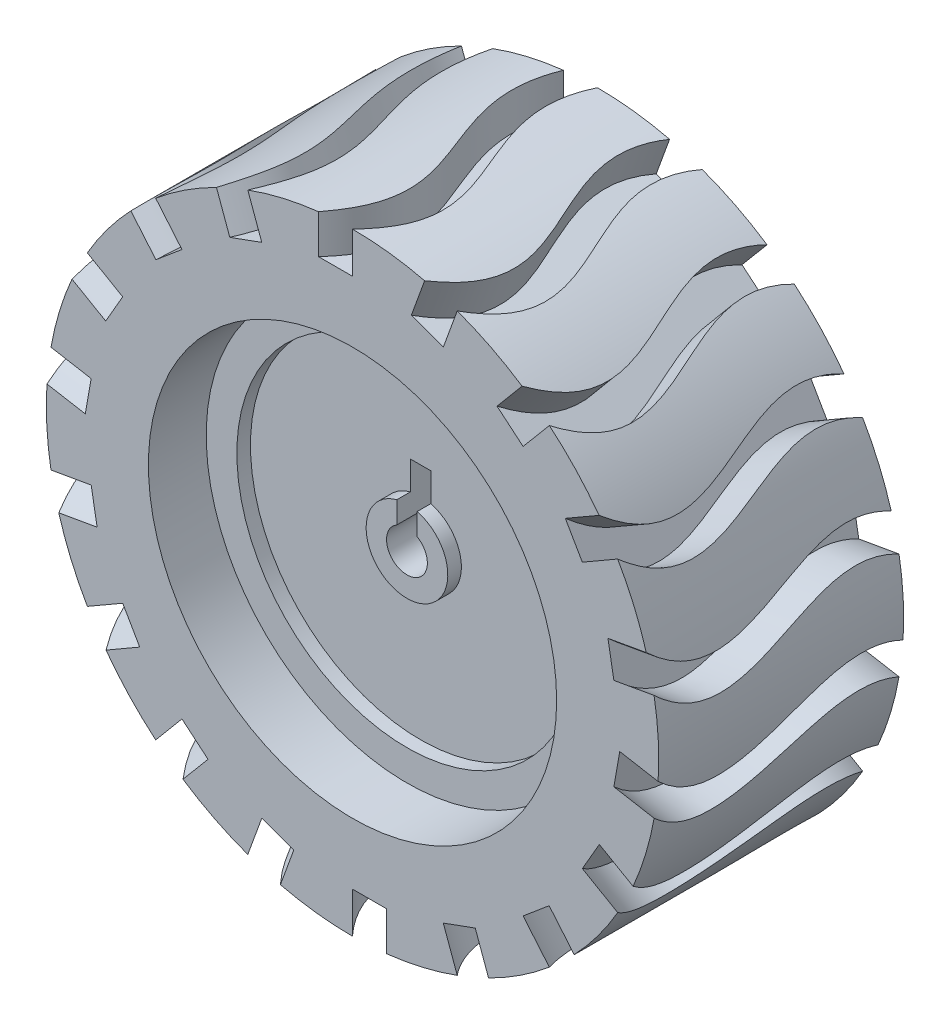
from build123d import *

# Parameters (mm, degrees)
SKETCH1_R            = 22.5
BOSS_EXTRUDE1_DEPTH  = 18
CUT_EXTRUDE1_DEPTH   = 5.5
CIRPATTERN1_START    = -22.500000114
CIRPATTERN1_DEPTH    = 3.000000114
CIRPATTERN1_START_2  = 19.5
CIRPATTERN1_2_DEPTH  = 3
CIRPATTERN1_3_DEPTH  = 3.000000114
CIRPATTERN1_4_DEPTH  = 3
CIRPATTERN1_5_DEPTH  = 3.000000114
CIRPATTERN1_6_DEPTH  = 3
CIRPATTERN1_7_DEPTH  = 3.000000114
CIRPATTERN1_8_DEPTH  = 3
CIRPATTERN1_9_DEPTH  = 3.000000114
CIRPATTERN1_10_DEPTH = 3
CIRPATTERN1_11_DEPTH = 3.000000114
CIRPATTERN1_12_DEPTH = 3
CIRPATTERN1_13_DEPTH = 3.000000114
CIRPATTERN1_14_DEPTH = 3
CIRPATTERN1_15_DEPTH = 3.000000114
CIRPATTERN1_16_DEPTH = 3
CIRPATTERN1_17_DEPTH = 3.000000114
SKETCH3_R            = 15
CUT_EXTRUDE2_DEPTH   = 18
SKETCH4_R            = 14.75
BOSS_EXTRUDE2_DEPTH  = 18
SKETCH5_R            = 14.75
CUT_EXTRUDE4_DEPTH   = 4
SKETCH6_R            = 14.75
CUT_EXTRUDE5_DEPTH   = 4
SKETCH7_R            = 12.5
SKETCH7_R_2          = 3
CUT_EXTRUDE11_DEPTH  = 1
SKETCH8_R            = 1.5
CUT_EXTRUDE12_DEPTH  = 20
SKETCH9_R            = 14.75
CUT_EXTRUDE13_DEPTH  = 1
SKETCH10_R           = 14.75
BOSS_EXTRUDE5_DEPTH  = 1
BOSS_EXTRUDE6_DEPTH  = 4
CUT_EXTRUDE14_DEPTH  = 20


# Read off the part's stored shape, not the designer's step: CirPattern1
with BuildPart() as part:
    # Sketch1 → Boss-Extrude1 (new body)
    with BuildSketch(Plane.XY):
        Circle(SKETCH1_R)
    extrude(amount=BOSS_EXTRUDE1_DEPTH)

    # Sketch2 → Cut-Extrude1 (cut)
    with BuildSketch(Plane(origin=(0, 25, 0), x_dir=(1, 0, 0), z_dir=(0, 1, 0))):
        with BuildLine():
            Line((-2.5, 0), (0, 0))
            add(Edge.make_bspline(
                [(0, 0), (-3.296301702, -6.593771616), (5.89267884, -11.683586078), (0, -18)],
                knots=[0, 0, 0, 0, 1, 1, 1, 1], degree=3))
            Line((0, -18), (-2.5, -18))
            add(Edge.make_bspline(
                [(-2.5, 0), (-5.796301702, -6.593771616), (3.39267884, -11.683586078), (-2.5, -18)],
                knots=[0, 0, 0, 0, 1, 1, 1, 1], degree=3))
        make_face()
    extrude(amount=-CUT_EXTRUDE1_DEPTH, mode=Mode.SUBTRACT)

    # CirPattern1 outline → CirPattern1 (cut)
    with BuildSketch(Plane(origin=(0, 0, 0), x_dir=(0.9396926207859082, 0.3420201433256691, 0), z_dir=(0.3420201433256691, -0.9396926207859083, 0)).offset(CIRPATTERN1_START)):
        with BuildLine():
            Line((-2.5, 0), (0, 0))
            add(Edge.make_bspline(
                [(0, 0), (-3.296301702, 6.593771616), (5.89267884, 11.683586078), (0, 18)],
                knots=[0.64127667, 0.64127667, 0.64127667, 0.64127667, 1.64127667, 1.64127667, 1.64127667, 1.64127667], degree=3))
            Line((0, 18), (-2.5, 18))
            add(Edge.make_bspline(
                [(-2.5, 18), (3.39267884, 11.683586078), (-5.796301702, 6.593771616), (-2.5, 0)],
                knots=[0.909473215, 0.909473215, 0.909473215, 0.909473215, 1.909473215, 1.909473215, 1.909473215, 1.909473215], degree=3))
        make_face()
    extrude(amount=CIRPATTERN1_DEPTH, mode=Mode.SUBTRACT)

    # CirPattern1 2 outline → CirPattern1 2 (cut)
    with BuildSketch(Plane(origin=(0, 0, 0), x_dir=(0.9396926207859082, 0.3420201433256691, 0), z_dir=(0.3420201433256691, -0.9396926207859083, 0)).offset(CIRPATTERN1_START_2)):
        with BuildLine():
            Line((0, 0), (2.5, 0))
            add(Edge.make_bspline(
                [(2.5, 0), (5.796301702, 6.593771616), (-3.39267884, 11.683586078), (2.5, 18)],
                knots=[0, 0, 0, 0, 1, 1, 1, 1], degree=3))
            Line((2.5, 18), (0, 18))
            add(Edge.make_bspline(
                [(0, 18), (-5.89267884, 11.683586078), (3.296301702, 6.593771616), (0, 0)],
                knots=[0, 0, 0, 0, 1, 1, 1, 1], degree=3))
        make_face()
    extrude(amount=CIRPATTERN1_2_DEPTH, mode=Mode.SUBTRACT)

    # CirPattern1 3 outline → CirPattern1 3 (cut)
    with BuildSketch(Plane(origin=(0, 0, 0), x_dir=(0.7660444431189772, 0.6427876096865403, 0), z_dir=(0.6427876096865403, -0.7660444431189772, 0)).offset(CIRPATTERN1_START)):
        with BuildLine():
            Line((-2.5, 0), (0, 0))
            add(Edge.make_bspline(
                [(0, 0), (-3.296301702, 6.593771616), (5.89267884, 11.683586078), (0, 18)],
                knots=[0.64127667, 0.64127667, 0.64127667, 0.64127667, 1.64127667, 1.64127667, 1.64127667, 1.64127667], degree=3))
            Line((0, 18), (-2.5, 18))
            add(Edge.make_bspline(
                [(-2.5, 18), (3.39267884, 11.683586078), (-5.796301702, 6.593771616), (-2.5, 0)],
                knots=[0.909473215, 0.909473215, 0.909473215, 0.909473215, 1.909473215, 1.909473215, 1.909473215, 1.909473215], degree=3))
        make_face()
    extrude(amount=CIRPATTERN1_3_DEPTH, mode=Mode.SUBTRACT)

    # CirPattern1 4 outline → CirPattern1 4 (cut)
    with BuildSketch(Plane(origin=(0, 0, 0), x_dir=(0.7660444431189772, 0.6427876096865403, 0), z_dir=(0.6427876096865403, -0.7660444431189772, 0)).offset(CIRPATTERN1_START_2)):
        with BuildLine():
            Line((0, 0), (2.5, 0))
            add(Edge.make_bspline(
                [(2.5, 0), (5.796301702, 6.593771616), (-3.39267884, 11.683586078), (2.5, 18)],
                knots=[0, 0, 0, 0, 1, 1, 1, 1], degree=3))
            Line((2.5, 18), (0, 18))
            add(Edge.make_bspline(
                [(0, 18), (-5.89267884, 11.683586078), (3.296301702, 6.593771616), (0, 0)],
                knots=[0, 0, 0, 0, 1, 1, 1, 1], degree=3))
        make_face()
    extrude(amount=CIRPATTERN1_4_DEPTH, mode=Mode.SUBTRACT)

    # CirPattern1 5 outline → CirPattern1 5 (cut)
    with BuildSketch(Plane(origin=(0, 0, 0), x_dir=(0.49999999999999833, 0.8660254037844396, 0), z_dir=(0.8660254037844397, -0.49999999999999784, 0)).offset(CIRPATTERN1_START)):
        with BuildLine():
            Line((-2.5, 0), (0, 0))
            add(Edge.make_bspline(
                [(0, 0), (-3.296301702, 6.593771616), (5.89267884, 11.683586078), (0, 18)],
                knots=[0.64127667, 0.64127667, 0.64127667, 0.64127667, 1.64127667, 1.64127667, 1.64127667, 1.64127667], degree=3))
            Line((0, 18), (-2.5, 18))
            add(Edge.make_bspline(
                [(-2.5, 18), (3.39267884, 11.683586078), (-5.796301702, 6.593771616), (-2.5, 0)],
                knots=[0.909473215, 0.909473215, 0.909473215, 0.909473215, 1.909473215, 1.909473215, 1.909473215, 1.909473215], degree=3))
        make_face()
    extrude(amount=CIRPATTERN1_5_DEPTH, mode=Mode.SUBTRACT)

    # CirPattern1 6 outline → CirPattern1 6 (cut)
    with BuildSketch(Plane(origin=(0, 0, 0), x_dir=(0.49999999999999833, 0.8660254037844396, 0), z_dir=(0.8660254037844397, -0.49999999999999784, 0)).offset(CIRPATTERN1_START_2)):
        with BuildLine():
            Line((0, 0), (2.5, 0))
            add(Edge.make_bspline(
                [(2.5, 0), (5.796301702, 6.593771616), (-3.39267884, 11.683586078), (2.5, 18)],
                knots=[0, 0, 0, 0, 1, 1, 1, 1], degree=3))
            Line((2.5, 18), (0, 18))
            add(Edge.make_bspline(
                [(0, 18), (-5.89267884, 11.683586078), (3.296301702, 6.593771616), (0, 0)],
                knots=[0, 0, 0, 0, 1, 1, 1, 1], degree=3))
        make_face()
    extrude(amount=CIRPATTERN1_6_DEPTH, mode=Mode.SUBTRACT)

    # CirPattern1 7 outline → CirPattern1 7 (cut)
    with BuildSketch(Plane(origin=(0, 0, 0), x_dir=(0.1736481776669279, 0.9848077530122085, 0), z_dir=(0.9848077530122085, -0.1736481776669279, 0)).offset(CIRPATTERN1_START)):
        with BuildLine():
            Line((-2.5, 0), (0, 0))
            add(Edge.make_bspline(
                [(0, 0), (-3.296301702, 6.593771616), (5.89267884, 11.683586078), (0, 18)],
                knots=[0.64127667, 0.64127667, 0.64127667, 0.64127667, 1.64127667, 1.64127667, 1.64127667, 1.64127667], degree=3))
            Line((0, 18), (-2.5, 18))
            add(Edge.make_bspline(
                [(-2.5, 18), (3.39267884, 11.683586078), (-5.796301702, 6.593771616), (-2.5, 0)],
                knots=[0.909473215, 0.909473215, 0.909473215, 0.909473215, 1.909473215, 1.909473215, 1.909473215, 1.909473215], degree=3))
        make_face()
    extrude(amount=CIRPATTERN1_7_DEPTH, mode=Mode.SUBTRACT)

    # CirPattern1 8 outline → CirPattern1 8 (cut)
    with BuildSketch(Plane(origin=(0, 0, 0), x_dir=(0.1736481776669279, 0.9848077530122085, 0), z_dir=(0.9848077530122085, -0.1736481776669279, 0)).offset(CIRPATTERN1_START_2)):
        with BuildLine():
            Line((0, 0), (2.5, 0))
            add(Edge.make_bspline(
                [(2.5, 0), (5.796301702, 6.593771616), (-3.39267884, 11.683586078), (2.5, 18)],
                knots=[0, 0, 0, 0, 1, 1, 1, 1], degree=3))
            Line((2.5, 18), (0, 18))
            add(Edge.make_bspline(
                [(0, 18), (-5.89267884, 11.683586078), (3.296301702, 6.593771616), (0, 0)],
                knots=[0, 0, 0, 0, 1, 1, 1, 1], degree=3))
        make_face()
    extrude(amount=CIRPATTERN1_8_DEPTH, mode=Mode.SUBTRACT)

    # CirPattern1 9 outline → CirPattern1 9 (cut)
    with BuildSketch(Plane(origin=(0, 0, 0), x_dir=(-0.17364817766693394, 0.9848077530122075, 0), z_dir=(0.9848077530122076, 0.1736481776669339, 0)).offset(CIRPATTERN1_START)):
        with BuildLine():
            Line((-2.5, 0), (0, 0))
            add(Edge.make_bspline(
                [(0, 0), (-3.296301702, 6.593771616), (5.89267884, 11.683586078), (0, 18)],
                knots=[0.64127667, 0.64127667, 0.64127667, 0.64127667, 1.64127667, 1.64127667, 1.64127667, 1.64127667], degree=3))
            Line((0, 18), (-2.5, 18))
            add(Edge.make_bspline(
                [(-2.5, 18), (3.39267884, 11.683586078), (-5.796301702, 6.593771616), (-2.5, 0)],
                knots=[0.909473215, 0.909473215, 0.909473215, 0.909473215, 1.909473215, 1.909473215, 1.909473215, 1.909473215], degree=3))
        make_face()
    extrude(amount=CIRPATTERN1_9_DEPTH, mode=Mode.SUBTRACT)

    # CirPattern1 10 outline → CirPattern1 10 (cut)
    with BuildSketch(Plane(origin=(0, 0, 0), x_dir=(-0.17364817766693394, 0.9848077530122075, 0), z_dir=(0.9848077530122076, 0.1736481776669339, 0)).offset(CIRPATTERN1_START_2)):
        with BuildLine():
            Line((0, 0), (2.5, 0))
            add(Edge.make_bspline(
                [(2.5, 0), (5.796301702, 6.593771616), (-3.39267884, 11.683586078), (2.5, 18)],
                knots=[0, 0, 0, 0, 1, 1, 1, 1], degree=3))
            Line((2.5, 18), (0, 18))
            add(Edge.make_bspline(
                [(0, 18), (-5.89267884, 11.683586078), (3.296301702, 6.593771616), (0, 0)],
                knots=[0, 0, 0, 0, 1, 1, 1, 1], degree=3))
        make_face()
    extrude(amount=CIRPATTERN1_10_DEPTH, mode=Mode.SUBTRACT)

    # CirPattern1 11 outline → CirPattern1 11 (cut)
    with BuildSketch(Plane(origin=(0, 0, 0), x_dir=(0.5000000000000041, -0.8660254037844364, 0), z_dir=(0.8660254037844364, 0.5000000000000037, 0)).offset(CIRPATTERN1_START)):
        with BuildLine():
            Line((2.5, 0), (0, 0))
            add(Edge.make_bspline(
                [(0, 0), (3.296301702, -6.593771616), (-5.89267884, -11.683586078), (0, -18)],
                knots=[0.64127667, 0.64127667, 0.64127667, 0.64127667, 1.64127667, 1.64127667, 1.64127667, 1.64127667], degree=3))
            Line((0, -18), (2.5, -18))
            add(Edge.make_bspline(
                [(2.5, -18), (-3.39267884, -11.683586078), (5.796301702, -6.593771616), (2.5, 0)],
                knots=[0.909473215, 0.909473215, 0.909473215, 0.909473215, 1.909473215, 1.909473215, 1.909473215, 1.909473215], degree=3))
        make_face()
    extrude(amount=CIRPATTERN1_11_DEPTH, mode=Mode.SUBTRACT)

    # CirPattern1 12 outline → CirPattern1 12 (cut)
    with BuildSketch(Plane(origin=(0, 0, 0), x_dir=(0.5000000000000041, -0.8660254037844364, 0), z_dir=(0.8660254037844364, 0.5000000000000037, 0)).offset(CIRPATTERN1_START_2)):
        with BuildLine():
            Line((0, 0), (-2.5, 0))
            add(Edge.make_bspline(
                [(-2.5, 0), (-5.796301702, -6.593771616), (3.39267884, -11.683586078), (-2.5, -18)],
                knots=[0, 0, 0, 0, 1, 1, 1, 1], degree=3))
            Line((-2.5, -18), (0, -18))
            add(Edge.make_bspline(
                [(0, -18), (5.89267884, -11.683586078), (-3.296301702, -6.593771616), (0, 0)],
                knots=[0, 0, 0, 0, 1, 1, 1, 1], degree=3))
        make_face()
    extrude(amount=CIRPATTERN1_12_DEPTH, mode=Mode.SUBTRACT)

    # CirPattern1 13 outline → CirPattern1 13 (cut)
    with BuildSketch(Plane(origin=(0, 0, 0), x_dir=(0.7660444431189815, -0.6427876096865353, 0), z_dir=(0.6427876096865353, 0.7660444431189813, 0)).offset(CIRPATTERN1_START)):
        with BuildLine():
            Line((2.5, 0), (0, 0))
            add(Edge.make_bspline(
                [(0, 0), (3.296301702, -6.593771616), (-5.89267884, -11.683586078), (0, -18)],
                knots=[0.64127667, 0.64127667, 0.64127667, 0.64127667, 1.64127667, 1.64127667, 1.64127667, 1.64127667], degree=3))
            Line((0, -18), (2.5, -18))
            add(Edge.make_bspline(
                [(2.5, -18), (-3.39267884, -11.683586078), (5.796301702, -6.593771616), (2.5, 0)],
                knots=[0.909473215, 0.909473215, 0.909473215, 0.909473215, 1.909473215, 1.909473215, 1.909473215, 1.909473215], degree=3))
        make_face()
    extrude(amount=CIRPATTERN1_13_DEPTH, mode=Mode.SUBTRACT)

    # CirPattern1 14 outline → CirPattern1 14 (cut)
    with BuildSketch(Plane(origin=(0, 0, 0), x_dir=(0.7660444431189815, -0.6427876096865353, 0), z_dir=(0.6427876096865353, 0.7660444431189813, 0)).offset(CIRPATTERN1_START_2)):
        with BuildLine():
            Line((0, 0), (-2.5, 0))
            add(Edge.make_bspline(
                [(-2.5, 0), (-5.796301702, -6.593771616), (3.39267884, -11.683586078), (-2.5, -18)],
                knots=[0, 0, 0, 0, 1, 1, 1, 1], degree=3))
            Line((-2.5, -18), (0, -18))
            add(Edge.make_bspline(
                [(0, -18), (5.89267884, -11.683586078), (-3.296301702, -6.593771616), (0, 0)],
                knots=[0, 0, 0, 0, 1, 1, 1, 1], degree=3))
        make_face()
    extrude(amount=CIRPATTERN1_14_DEPTH, mode=Mode.SUBTRACT)

    # CirPattern1 15 outline → CirPattern1 15 (cut)
    with BuildSketch(Plane(origin=(0, 0, 0), x_dir=(0.9396926207859104, -0.3420201433256631, 0), z_dir=(0.34202014332566316, 0.9396926207859103, 0)).offset(CIRPATTERN1_START)):
        with BuildLine():
            Line((2.5, 0), (0, 0))
            add(Edge.make_bspline(
                [(0, 0), (3.296301702, -6.593771616), (-5.89267884, -11.683586078), (0, -18)],
                knots=[0.64127667, 0.64127667, 0.64127667, 0.64127667, 1.64127667, 1.64127667, 1.64127667, 1.64127667], degree=3))
            Line((0, -18), (2.5, -18))
            add(Edge.make_bspline(
                [(2.5, -18), (-3.39267884, -11.683586078), (5.796301702, -6.593771616), (2.5, 0)],
                knots=[0.909473215, 0.909473215, 0.909473215, 0.909473215, 1.909473215, 1.909473215, 1.909473215, 1.909473215], degree=3))
        make_face()
    extrude(amount=CIRPATTERN1_15_DEPTH, mode=Mode.SUBTRACT)

    # CirPattern1 16 outline → CirPattern1 16 (cut)
    with BuildSketch(Plane(origin=(0, 0, 0), x_dir=(0.9396926207859104, -0.3420201433256631, 0), z_dir=(0.34202014332566316, 0.9396926207859103, 0)).offset(CIRPATTERN1_START_2)):
        with BuildLine():
            Line((0, 0), (-2.5, 0))
            add(Edge.make_bspline(
                [(-2.5, 0), (-5.796301702, -6.593771616), (3.39267884, -11.683586078), (-2.5, -18)],
                knots=[0, 0, 0, 0, 1, 1, 1, 1], degree=3))
            Line((-2.5, -18), (0, -18))
            add(Edge.make_bspline(
                [(0, -18), (5.89267884, -11.683586078), (-3.296301702, -6.593771616), (0, 0)],
                knots=[0, 0, 0, 0, 1, 1, 1, 1], degree=3))
        make_face()
    extrude(amount=CIRPATTERN1_16_DEPTH, mode=Mode.SUBTRACT)

    # CirPattern1 17 outline → CirPattern1 17 (cut)
    with BuildSketch(Plane(origin=(0, 0, 0), x_dir=(1, 0, 0), z_dir=(0, 1, 0)).offset(CIRPATTERN1_START)):
        with BuildLine():
            add(Edge.make_bspline(
                [(2.5, 0), (5.796301702, -6.593771616), (-3.39267884, -11.683586078), (2.5, -18)],
                knots=[0, 0, 0, 0, 1, 1, 1, 1], degree=3))
            Line((2.5, 0), (0, 0))
            add(Edge.make_bspline(
                [(0, -18), (-5.89267884, -11.683586078), (3.296301702, -6.593771616), (0, 0)],
                knots=[0, 0, 0, 0, 1, 1, 1, 1], degree=3))
            Line((0, -18), (2.5, -18))
        make_face()
    extrude(amount=CIRPATTERN1_17_DEPTH, mode=Mode.SUBTRACT)

    # Sketch3 → Cut-Extrude2 (cut)
    with BuildSketch(Plane.XY.offset(18)):
        Circle(SKETCH3_R)
    extrude(amount=-CUT_EXTRUDE2_DEPTH, mode=Mode.SUBTRACT)


with BuildPart() as body_2:
    # Sketch4 → Boss-Extrude2 (new body)
    with BuildSketch(Plane.XY):
        Circle(SKETCH4_R)
    extrude(amount=BOSS_EXTRUDE2_DEPTH)

    # Sketch5 → Cut-Extrude4 (cut)
    with BuildSketch(Plane(origin=(0, 0, 0), x_dir=(-1, 0, 0), z_dir=(0, 0, -1))):
        Circle(SKETCH5_R)
    extrude(amount=-CUT_EXTRUDE4_DEPTH, mode=Mode.SUBTRACT)

    # Sketch6 → Cut-Extrude5 (cut)
    with BuildSketch(Plane.XY.offset(18)):
        with Locations(Location((0, 0, 0), (0, 0, 180))):
            Circle(SKETCH6_R)
    extrude(amount=-CUT_EXTRUDE5_DEPTH, mode=Mode.SUBTRACT)

    # Sketch7 → Cut-Extrude11 (cut)
    with BuildSketch(Plane.XY.offset(14)):
        Circle(SKETCH7_R)
        Circle(SKETCH7_R_2, mode=Mode.SUBTRACT)
    extrude(amount=-CUT_EXTRUDE11_DEPTH, mode=Mode.SUBTRACT)

    # Sketch8 → Cut-Extrude12 (cut)
    with BuildSketch(Plane.XY.offset(14)):
        Circle(SKETCH8_R)
    extrude(amount=-CUT_EXTRUDE12_DEPTH, mode=Mode.SUBTRACT)

    # Sketch9 → Cut-Extrude13 (cut)
    with BuildSketch(Plane(origin=(0, 0, 4), x_dir=(-1, 0, 0), z_dir=(0, 0, -1))):
        Circle(SKETCH9_R)
    extrude(amount=-CUT_EXTRUDE13_DEPTH, mode=Mode.SUBTRACT)

    # Sketch10 → Boss-Extrude5 (add)
    # profile 1 of 27: a face of its own
    with BuildSketch(Plane(origin=(0, 0, 5), x_dir=(-1, 0, 0), z_dir=(0, 0, -1))):
        Circle(SKETCH10_R)
        with BuildLine():
            ThreePointArc((-7.095993301, -10.290620927), (-10.825317547, -6.25), (-12.459935794, -1))
            Line((-12.459935794, -1), (-14, -1))
            Line((-14, -1), (-14, 1))
            Line((-14, 1), (-12.459935794, 1))
            ThreePointArc((-12.459935794, 1), (-10.825317547, 6.25), (-7.095993301, 10.290620927))
            Line((-7.095993301, 10.290620927), (-7.866025404, 11.624355653))
            Line((-7.866025404, 11.624355653), (-6.133974596, 12.624355653))
            Line((-6.133974596, 12.624355653), (-5.363942493, 11.290620927))
            ThreePointArc((-5.363942493, 11.290620927), (0, 12.5), (5.363942493, 11.290620927))
            Line((5.363942493, 11.290620927), (6.133974596, 12.624355653))
            Line((6.133974596, 12.624355653), (7.866025404, 11.624355653))
            Line((7.866025404, 11.624355653), (7.095993301, 10.290620927))
            ThreePointArc((7.095993301, 10.290620927), (10.825317547, 6.25), (12.459935794, 1))
            Line((12.459935794, 1), (14, 1))
            Line((14, 1), (14, -1))
            Line((14, -1), (12.459935794, -1))
            ThreePointArc((12.459935794, -1), (10.825317547, -6.25), (7.095993301, -10.290620927))
            Line((7.095993301, -10.290620927), (7.866025404, -11.624355653))
            Line((7.866025404, -11.624355653), (6.133974596, -12.624355653))
            Line((6.133974596, -12.624355653), (5.363942493, -11.290620927))
            ThreePointArc((5.363942493, -11.290620927), (0, -12.5), (-5.363942493, -11.290620927))
            Line((-5.363942493, -11.290620927), (-6.133974596, -12.624355653))
            Line((-6.133974596, -12.624355653), (-7.866025404, -11.624355653))
            Line((-7.866025404, -11.624355653), (-7.095993301, -10.290620927))
        make_face(mode=Mode.SUBTRACT)
    # profile 2 of 27: a face of its own
    with BuildSketch(Plane(origin=(0, 0, 5), x_dir=(-1, 0, 0), z_dir=(0, 0, -1))):
        with BuildLine():
            ThreePointArc((-0.548188159, -2.949489743), (-1.5, -2.598076211), (-2.280238966, -1.949489743))
            Line((-2.280238966, -1.949489743), (-7.095993301, -10.290620927))
            ThreePointArc((-7.095993301, -10.290620927), (-6.25, -10.825317547), (-5.363942493, -11.290620927))
            Line((-5.363942493, -11.290620927), (-0.548188159, -2.949489743))
        make_face()
    # profile 3 of 27: a face of its own
    with BuildSketch(Plane(origin=(0, 0, 5), x_dir=(-1, 0, 0), z_dir=(0, 0, -1))):
        with BuildLine():
            Line((-12.459935794, -1), (-2.828427125, -1))
            ThreePointArc((-2.828427125, -1), (-3, 0), (-2.828427125, 1))
            Line((-2.828427125, 1), (-12.459935794, 1))
            ThreePointArc((-12.459935794, 1), (-12.5, 0), (-12.459935794, -1))
        make_face()
    # profile 4 of 27: a face of its own
    with BuildSketch(Plane(origin=(0, 0, 5), x_dir=(-1, 0, 0), z_dir=(0, 0, -1))):
        with BuildLine():
            ThreePointArc((2.280238966, -1.949489743), (1.5, -2.598076211), (0.548188159, -2.949489743))
            Line((0.548188159, -2.949489743), (5.363942493, -11.290620927))
            ThreePointArc((5.363942493, -11.290620927), (6.25, -10.825317547), (7.095993301, -10.290620927))
            Line((7.095993301, -10.290620927), (2.280238966, -1.949489743))
        make_face()
    # profile 5 of 27: a face of its own
    with BuildSketch(Plane(origin=(0, 0, 5), x_dir=(-1, 0, 0), z_dir=(0, 0, -1))):
        with BuildLine():
            ThreePointArc((2.828427125, 1), (3, 0), (2.828427125, -1))
            Line((2.828427125, -1), (12.459935794, -1))
            ThreePointArc((12.459935794, -1), (12.489979933, -0.500401124), (12.5, 0))
            ThreePointArc((12.5, 0), (12.489979933, 0.500401124), (12.459935794, 1))
            Line((12.459935794, 1), (2.828427125, 1))
        make_face()
    # profile 6 of 27: a face of its own
    with BuildSketch(Plane(origin=(0, 0, 5), x_dir=(-1, 0, 0), z_dir=(0, 0, -1))):
        with BuildLine():
            Line((0.75, 3.299038106), (0.75, 2.90473751))
            ThreePointArc((0.75, 2.90473751), (1.588619408, 2.544855276), (2.280238966, 1.949489743))
            Line((2.280238966, 1.949489743), (7.095993301, 10.290620927))
            ThreePointArc((7.095993301, 10.290620927), (6.25, 10.825317547), (5.363942493, 11.290620927))
            Line((5.363942493, 11.290620927), (0.75, 3.299038106))
        make_face()
    # profile 7 of 27: a face of its own
    with BuildSketch(Plane(origin=(0, 0, 5), x_dir=(-1, 0, 0), z_dir=(0, 0, -1))):
        with BuildLine():
            ThreePointArc((-2.280238966, 1.949489743), (-1.588619408, 2.544855276), (-0.75, 2.90473751))
            Line((-0.75, 2.90473751), (-0.75, 3.299038106))
            Line((-0.75, 3.299038106), (-5.363942493, 11.290620927))
            ThreePointArc((-5.363942493, 11.290620927), (-6.25, 10.825317547), (-7.095993301, 10.290620927))
            Line((-7.095993301, 10.290620927), (-2.280238966, 1.949489743))
        make_face()
    # profile 8 of 27: a face of its own
    with BuildSketch(Plane(origin=(0, 0, 5), x_dir=(-1, 0, 0), z_dir=(0, 0, -1))):
        with BuildLine():
            ThreePointArc((-0.307008409, -1.468245837), (-0.75, -1.299038106), (-1.118033989, -1))
            Line((-1.118033989, -1), (-1.732050808, -1))
            Line((-1.732050808, -1), (-2.280238966, -1.949489743))
            ThreePointArc((-2.280238966, -1.949489743), (-1.5, -2.598076211), (-0.548188159, -2.949489743))
            Line((-0.548188159, -2.949489743), (0, -2))
            Line((0, -2), (-0.307008409, -1.468245837))
        make_face()
    # profile 9 of 27: a face of its own
    with BuildSketch(Plane(origin=(0, 0, 5), x_dir=(-1, 0, 0), z_dir=(0, 0, -1))):
        with BuildLine():
            Line((-2.280238966, -1.949489743), (-1.732050808, -1))
            Line((-1.732050808, -1), (-2.828427125, -1))
            ThreePointArc((-2.828427125, -1), (-2.598076211, -1.5), (-2.280238966, -1.949489743))
        make_face()
    # profile 10 of 27: a face of its own
    with BuildSketch(Plane(origin=(0, 0, 5), x_dir=(-1, 0, 0), z_dir=(0, 0, -1))):
        with BuildLine():
            Line((-2.828427125, -1), (-1.732050808, -1))
            Line((-1.732050808, -1), (-1.425042398, -0.468245837))
            ThreePointArc((-1.425042398, -0.468245837), (-1.5, 0), (-1.425042398, 0.468245837))
            Line((-1.425042398, 0.468245837), (-1.732050808, 1))
            Line((-1.732050808, 1), (-2.828427125, 1))
            ThreePointArc((-2.828427125, 1), (-3, 0), (-2.828427125, -1))
        make_face()
    # profile 11 of 27: a face of its own
    with BuildSketch(Plane(origin=(0, 0, 5), x_dir=(-1, 0, 0), z_dir=(0, 0, -1))):
        with BuildLine():
            Line((-1.732050808, 1), (-1.118033989, 1))
            ThreePointArc((-1.118033989, 1), (-0.945908924, 1.164154761), (-0.75, 1.299038106))
            Line((-0.75, 1.299038106), (-0.75, 2.90473751))
            ThreePointArc((-0.75, 2.90473751), (-1.588619408, 2.544855276), (-2.280238966, 1.949489743))
            Line((-2.280238966, 1.949489743), (-1.732050808, 1))
        make_face()
    # profile 12 of 27: a face of its own
    with BuildSketch(Plane(origin=(0, 0, 5), x_dir=(-1, 0, 0), z_dir=(0, 0, -1))):
        with BuildLine():
            Line((-2.828427125, 1), (-1.732050808, 1))
            Line((-1.732050808, 1), (-2.280238966, 1.949489743))
            ThreePointArc((-2.280238966, 1.949489743), (-2.598076211, 1.5), (-2.828427125, 1))
        make_face()
    # profile 13 of 27: a face of its own
    with BuildSketch(Plane(origin=(0, 0, 5), x_dir=(-1, 0, 0), z_dir=(0, 0, -1))):
        with BuildLine():
            Line((0.75, 2.90473751), (0.75, 1.299038106))
            ThreePointArc((0.75, 1.299038106), (0.945908924, 1.164154761), (1.118033989, 1))
            Line((1.118033989, 1), (1.732050808, 1))
            Line((1.732050808, 1), (2.280238966, 1.949489743))
            ThreePointArc((2.280238966, 1.949489743), (1.588619408, 2.544855276), (0.75, 2.90473751))
        make_face()
    # profile 14 of 27: a face of its own
    with BuildSketch(Plane(origin=(0, 0, 5), x_dir=(-1, 0, 0), z_dir=(0, 0, -1))):
        with BuildLine():
            Line((2.280238966, 1.949489743), (1.732050808, 1))
            Line((1.732050808, 1), (2.828427125, 1))
            ThreePointArc((2.828427125, 1), (2.598076211, 1.5), (2.280238966, 1.949489743))
        make_face()
    # profile 15 of 27: a face of its own
    with BuildSketch(Plane(origin=(0, 0, 5), x_dir=(-1, 0, 0), z_dir=(0, 0, -1))):
        with BuildLine():
            Line((1.425042398, -0.468245837), (1.732050808, -1))
            Line((1.732050808, -1), (2.828427125, -1))
            ThreePointArc((2.828427125, -1), (3, 0), (2.828427125, 1))
            Line((2.828427125, 1), (1.732050808, 1))
            Line((1.732050808, 1), (1.425042398, 0.468245837))
            ThreePointArc((1.425042398, 0.468245837), (1.481142059, 0.237103778), (1.5, 0))
            ThreePointArc((1.5, 0), (1.481142059, -0.237103778), (1.425042398, -0.468245837))
        make_face()
    # profile 16 of 27: a face of its own
    with BuildSketch(Plane(origin=(0, 0, 5), x_dir=(-1, 0, 0), z_dir=(0, 0, -1))):
        with BuildLine():
            Line((1.732050808, -1), (1.118033989, -1))
            ThreePointArc((1.118033989, -1), (0.75, -1.299038106), (0.307008409, -1.468245837))
            Line((0.307008409, -1.468245837), (0, -2))
            Line((0, -2), (0.548188159, -2.949489743))
            ThreePointArc((0.548188159, -2.949489743), (1.5, -2.598076211), (2.280238966, -1.949489743))
            Line((2.280238966, -1.949489743), (1.732050808, -1))
        make_face()
    # profile 17 of 27: a face of its own
    with BuildSketch(Plane(origin=(0, 0, 5), x_dir=(-1, 0, 0), z_dir=(0, 0, -1))):
        with BuildLine():
            ThreePointArc((1.425042398, -0.468245837), (1.299038106, -0.75), (1.118033989, -1))
            Line((1.118033989, -1), (1.732050808, -1))
            Line((1.732050808, -1), (1.425042398, -0.468245837))
        make_face()
    # profile 18 of 27: a face of its own
    with BuildSketch(Plane(origin=(0, 0, 5), x_dir=(-1, 0, 0), z_dir=(0, 0, -1))):
        with BuildLine():
            Line((-1.732050808, -1), (-1.118033989, -1))
            ThreePointArc((-1.118033989, -1), (-1.299038106, -0.75), (-1.425042398, -0.468245837))
            Line((-1.425042398, -0.468245837), (-1.732050808, -1))
        make_face()
    # profile 19 of 27: a face of its own
    with BuildSketch(Plane(origin=(0, 0, 5), x_dir=(-1, 0, 0), z_dir=(0, 0, -1))):
        with BuildLine():
            ThreePointArc((0.307008409, -1.468245837), (0, -1.5), (-0.307008409, -1.468245837))
            Line((-0.307008409, -1.468245837), (0, -2))
            Line((0, -2), (0.307008409, -1.468245837))
        make_face()
    # profile 20 of 27: a face of its own
    with BuildSketch(Plane(origin=(0, 0, 5), x_dir=(-1, 0, 0), z_dir=(0, 0, -1))):
        with BuildLine():
            ThreePointArc((-1.425042398, 0.468245837), (-1.299038106, 0.75), (-1.118033989, 1))
            Line((-1.118033989, 1), (-1.732050808, 1))
            Line((-1.732050808, 1), (-1.425042398, 0.468245837))
        make_face()
    # profile 21 of 27: a face of its own
    with BuildSketch(Plane(origin=(0, 0, 5), x_dir=(-1, 0, 0), z_dir=(0, 0, -1))):
        with BuildLine():
            Line((1.732050808, 1), (1.118033989, 1))
            ThreePointArc((1.118033989, 1), (1.299038106, 0.75), (1.425042398, 0.468245837))
            Line((1.425042398, 0.468245837), (1.732050808, 1))
        make_face()
    # profile 22 of 27: a face of its own
    with BuildSketch(Plane(origin=(0, 0, 5), x_dir=(-1, 0, 0), z_dir=(0, 0, -1))):
        with BuildLine():
            ThreePointArc((7.095993301, -10.290620927), (6.25, -10.825317547), (5.363942493, -11.290620927))
            Line((5.363942493, -11.290620927), (6.133974596, -12.624355653))
            Line((6.133974596, -12.624355653), (7.866025404, -11.624355653))
            Line((7.866025404, -11.624355653), (7.095993301, -10.290620927))
        make_face()
    # profile 23 of 27: a face of its own
    with BuildSketch(Plane(origin=(0, 0, 5), x_dir=(-1, 0, 0), z_dir=(0, 0, -1))):
        with BuildLine():
            ThreePointArc((12.5, 0), (12.489979933, -0.500401124), (12.459935794, -1))
            Line((12.459935794, -1), (14, -1))
            Line((14, -1), (14, 1))
            Line((14, 1), (12.459935794, 1))
            ThreePointArc((12.459935794, 1), (12.489979933, 0.500401124), (12.5, 0))
        make_face()
    # profile 24 of 27: a face of its own
    with BuildSketch(Plane(origin=(0, 0, 5), x_dir=(-1, 0, 0), z_dir=(0, 0, -1))):
        with BuildLine():
            ThreePointArc((-5.363942493, -11.290620927), (-6.25, -10.825317547), (-7.095993301, -10.290620927))
            Line((-7.095993301, -10.290620927), (-7.866025404, -11.624355653))
            Line((-7.866025404, -11.624355653), (-6.133974596, -12.624355653))
            Line((-6.133974596, -12.624355653), (-5.363942493, -11.290620927))
        make_face()
    # profile 25 of 27: a face of its own
    with BuildSketch(Plane(origin=(0, 0, 5), x_dir=(-1, 0, 0), z_dir=(0, 0, -1))):
        with BuildLine():
            Line((-14, -1), (-12.459935794, -1))
            ThreePointArc((-12.459935794, -1), (-12.5, 0), (-12.459935794, 1))
            Line((-12.459935794, 1), (-14, 1))
            Line((-14, 1), (-14, -1))
        make_face()
    # profile 26 of 27: a face of its own
    with BuildSketch(Plane(origin=(0, 0, 5), x_dir=(-1, 0, 0), z_dir=(0, 0, -1))):
        with BuildLine():
            Line((-7.866025404, 11.624355653), (-7.095993301, 10.290620927))
            ThreePointArc((-7.095993301, 10.290620927), (-6.25, 10.825317547), (-5.363942493, 11.290620927))
            Line((-5.363942493, 11.290620927), (-6.133974596, 12.624355653))
            Line((-6.133974596, 12.624355653), (-7.866025404, 11.624355653))
        make_face()
    # profile 27 of 27: a face of its own
    with BuildSketch(Plane(origin=(0, 0, 5), x_dir=(-1, 0, 0), z_dir=(0, 0, -1))):
        with BuildLine():
            Line((6.133974596, 12.624355653), (5.363942493, 11.290620927))
            ThreePointArc((5.363942493, 11.290620927), (6.25, 10.825317547), (7.095993301, 10.290620927))
            Line((7.095993301, 10.290620927), (7.866025404, 11.624355653))
            Line((7.866025404, 11.624355653), (6.133974596, 12.624355653))
        make_face()
    extrude(amount=BOSS_EXTRUDE5_DEPTH)

    # Sketch11 → Boss-Extrude6 (add)
    with BuildSketch(Plane(origin=(0, 0, 4), x_dir=(-1, 0, 0), z_dir=(0, 0, -1))):
        with BuildLine():
            Line((12.5, 0), (14.75, 0))
            ThreePointArc((14.75, 0), (14.623811705, 1.925261335), (14.247405938, 3.817580915))
            Line((14.247405938, 3.817580915), (12.074072829, 3.235238064))
            ThreePointArc((12.074072829, 3.235238064), (12.393060767, 1.631577403), (12.5, 0))
        make_face()
        with BuildLine():
            Line((12.074072829, -3.235238064), (14.247405938, -3.817580915))
            ThreePointArc((14.247405938, -3.817580915), (13.627223105, -5.644580627), (12.773874706, -7.375))
            Line((12.773874706, -7.375), (10.825317547, -6.25))
            ThreePointArc((10.825317547, -6.25), (11.548494156, -4.783542905), (12.074072829, -3.235238064))
        make_face()
        with BuildLine():
            Line((8.838834765, -8.838834765), (10.429825023, -10.429825023))
            ThreePointArc((10.429825023, -10.429825023), (8.979231078, -11.701961769), (7.375, -12.773874706))
            Line((7.375, -12.773874706), (6.25, -10.825317547))
            ThreePointArc((6.25, -10.825317547), (7.609517863, -9.916916754), (8.838834765, -8.838834765))
        make_face()
        with BuildLine():
            Line((3.235238064, -12.074072829), (3.817580915, -14.247405938))
            ThreePointArc((3.817580915, -14.247405938), (1.925261335, -14.623811705), (0, -14.75))
            Line((0, -14.75), (0, -12.5))
            ThreePointArc((0, -12.5), (1.631577403, -12.393060767), (3.235238064, -12.074072829))
        make_face()
        with BuildLine():
            Line((-3.235238064, -12.074072829), (-3.817580915, -14.247405938))
            ThreePointArc((-3.817580915, -14.247405938), (-5.644580627, -13.627223105), (-7.375, -12.773874706))
            Line((-7.375, -12.773874706), (-6.25, -10.825317547))
            ThreePointArc((-6.25, -10.825317547), (-4.783542905, -11.548494156), (-3.235238064, -12.074072829))
        make_face()
        with BuildLine():
            Line((-8.838834765, -8.838834765), (-10.429825023, -10.429825023))
            ThreePointArc((-10.429825023, -10.429825023), (-11.701961769, -8.979231078), (-12.773874706, -7.375))
            Line((-12.773874706, -7.375), (-10.825317547, -6.25))
            ThreePointArc((-10.825317547, -6.25), (-9.916916754, -7.609517863), (-8.838834765, -8.838834765))
        make_face()
        with BuildLine():
            Line((-12.074072829, -3.235238064), (-14.247405938, -3.817580915))
            ThreePointArc((-14.247405938, -3.817580915), (-14.623811705, -1.925261335), (-14.75, 0))
            Line((-14.75, 0), (-12.5, 0))
            ThreePointArc((-12.5, 0), (-12.393060767, -1.631577403), (-12.074072829, -3.235238064))
        make_face()
        with BuildLine():
            Line((-12.074072829, 3.235238064), (-14.247405938, 3.817580915))
            ThreePointArc((-14.247405938, 3.817580915), (-13.627223105, 5.644580627), (-12.773874706, 7.375))
            Line((-12.773874706, 7.375), (-10.825317547, 6.25))
            ThreePointArc((-10.825317547, 6.25), (-11.548494156, 4.783542905), (-12.074072829, 3.235238064))
        make_face()
        with BuildLine():
            Line((-8.838834765, 8.838834765), (-10.429825023, 10.429825023))
            ThreePointArc((-10.429825023, 10.429825023), (-8.979231078, 11.701961769), (-7.375, 12.773874706))
            Line((-7.375, 12.773874706), (-6.25, 10.825317547))
            ThreePointArc((-6.25, 10.825317547), (-7.609517863, 9.916916754), (-8.838834765, 8.838834765))
        make_face()
        with BuildLine():
            Line((-3.235238064, 12.074072829), (-3.817580915, 14.247405938))
            ThreePointArc((-3.817580915, 14.247405938), (-1.925261335, 14.623811705), (0, 14.75))
            Line((0, 14.75), (0, 12.5))
            ThreePointArc((0, 12.5), (-1.631577403, 12.393060767), (-3.235238064, 12.074072829))
        make_face()
        with BuildLine():
            Line((3.235238064, 12.074072829), (3.817580915, 14.247405938))
            ThreePointArc((3.817580915, 14.247405938), (5.644580627, 13.627223105), (7.375, 12.773874706))
            Line((7.375, 12.773874706), (6.25, 10.825317547))
            ThreePointArc((6.25, 10.825317547), (4.783542905, 11.548494156), (3.235238064, 12.074072829))
        make_face()
        with BuildLine():
            Line((8.838834765, 8.838834765), (10.429825023, 10.429825023))
            ThreePointArc((10.429825023, 10.429825023), (11.701961769, 8.979231078), (12.773874706, 7.375))
            Line((12.773874706, 7.375), (10.825317547, 6.25))
            ThreePointArc((10.825317547, 6.25), (9.916916754, 7.609517863), (8.838834765, 8.838834765))
        make_face()
    extrude(amount=BOSS_EXTRUDE6_DEPTH)

    # Sketch12 → Cut-Extrude14 (cut)
    with BuildSketch(Plane(origin=(0, 0, 4), x_dir=(-1, 0, 0), z_dir=(0, 0, -1))):
        Polygon((0, 0), (-0.75, 0), (-0.75, 5), (0.75, 5), (0.75, 0), align=None)
    extrude(amount=-CUT_EXTRUDE14_DEPTH, mode=Mode.SUBTRACT)


solid = Compound([part.part, body_2.part])
